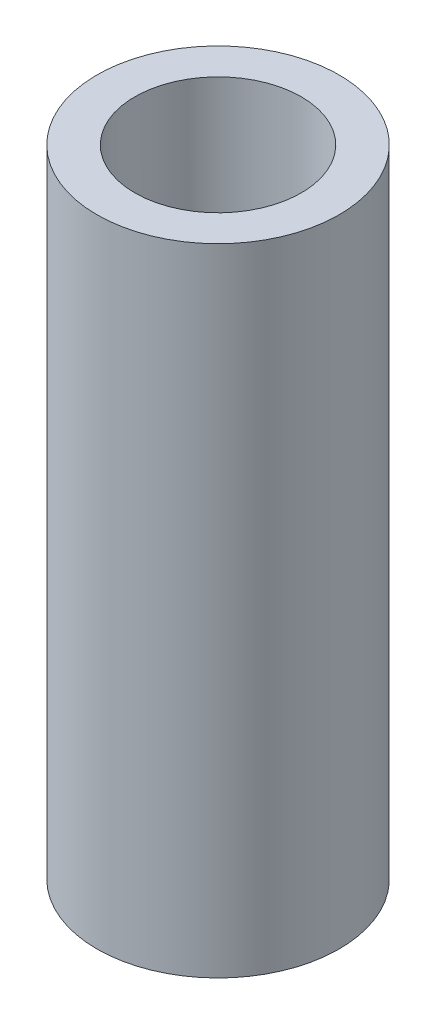
from build123d import *

# Parameters (mm, degrees)
SKETCH1_R           = 4
BOSS_EXTRUDE1_DEPTH = 21
SKETCH2_R           = 3.2
CUT_EXTRUDE1_DEPTH  = 10
SKETCH3_R           = 2.75
CUT_EXTRUDE3_DEPTH  = 10


with BuildPart() as part:
    # Sketch1 → Boss-Extrude1 (new body)
    with BuildSketch(Plane(origin=(0, 0, 0), x_dir=(1, 0, 0), z_dir=(0, 1, 0))):
        with Locations(Location((0, 0, 0), (0, 0, 90))):
            Circle(SKETCH1_R)
    extrude(amount=BOSS_EXTRUDE1_DEPTH)

    # Sketch2 → Cut-Extrude1 (cut)
    with BuildSketch(Plane.XZ):
        with Locations(Location((0, 0, 0), (0, 0, 270))):
            Circle(SKETCH2_R)
    extrude(amount=-CUT_EXTRUDE1_DEPTH, mode=Mode.SUBTRACT)

    # Sketch3 → Cut-Extrude3 (cut)
    with BuildSketch(Plane(origin=(0, 21, 0), x_dir=(1, 0, 0), z_dir=(0, 1, 0))):
        with Locations(Location((0, 0, 0), (0, 0, 270))):
            Circle(SKETCH3_R)
    extrude(amount=-CUT_EXTRUDE3_DEPTH, mode=Mode.SUBTRACT)

    # Cut-Extrude5: read off the stored shape, not the designer's step
    # Cut-Extrude5: loft between two sections, ruled curve by curve
    cut_extrude5_from = [
        Edge.make_three_point_arc((-2.36677924, 14.6, 0), (-2.36677924, 16, 1.4), (-2.36677924, 17.4, 0)),
        Edge.make_three_point_arc((-2.36677924, 17.4, 0), (-2.36677924, 16, -1.4), (-2.36677924, 14.6, 0)),
    ]
    cut_extrude5_to = [
        Edge.make_three_point_arc((-3.999916451, 14.6, 0), (-3.999916451, 16, 1.4), (-3.999916451, 17.4, 0)),
        Edge.make_three_point_arc((-3.999916451, 17.4, 0), (-3.999916451, 16, -1.4), (-3.999916451, 14.6, 0)),
    ]
    cut_extrude5 = Solid(Shell([*[Face.make_surface_from_curves(cut_extrude5_from[k], cut_extrude5_to[k]) for k in range(2)], Face(Wire(cut_extrude5_from)), Face(Wire(cut_extrude5_to))]))
    add(cut_extrude5, mode=Mode.SUBTRACT)

    # Cut-Extrude5 2: loft between two sections, ruled curve by curve
    cut_extrude5_2_from = [
        Edge.make_three_point_arc((-2.877351837, 3.6, 0), (-2.877351837, 5, 1.4), (-2.877351837, 6.4, 0)),
        Edge.make_three_point_arc((-2.877351837, 6.4, 0), (-2.877351837, 5, -1.4), (-2.877351837, 3.6, 0)),
    ]
    cut_extrude5_2_to = [
        Edge.make_three_point_arc((-3.999916451, 3.6, 0), (-3.999916451, 5, 1.4), (-3.999916451, 6.4, 0)),
        Edge.make_three_point_arc((-3.999916451, 6.4, 0), (-3.999916451, 5, -1.4), (-3.999916451, 3.6, 0)),
    ]
    cut_extrude5_2 = Solid(Shell([*[Face.make_surface_from_curves(cut_extrude5_2_from[k], cut_extrude5_2_to[k]) for k in range(2)], Face(Wire(cut_extrude5_2_from)), Face(Wire(cut_extrude5_2_to))]))
    add(cut_extrude5_2, mode=Mode.SUBTRACT)


solid = part.part
